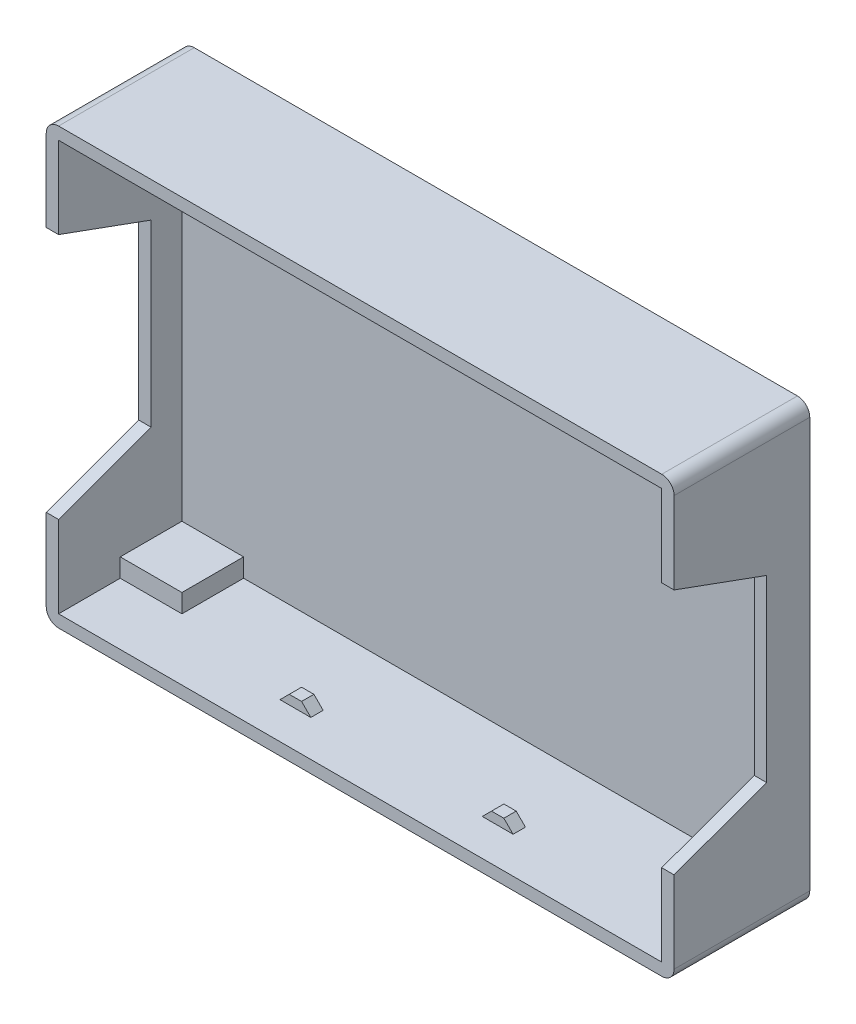
from build123d import *

# Parameters (mm, degrees)
SKETCH1_W                            = 70.5
SKETCH1_H                            = 101.8
SKETCH1_W_2                          = 66.5
SKETCH1_H_2                          = 97.8
BOSS_EXTRUDE1_BOARD_4MM_DEPTH        = 10
SKETCH2_W                            = 101.8
SKETCH2_H                            = 70.5
BOSS_EXTRUDE2_UNDER_10MS_DEPTH       = 10
SKETCH3_W                            = 101.8
SKETCH3_H                            = 70.5
BOSS_EXTRUDE3_BOTTOM_COVER_2MM_DEPTH = 2
SKETCH4_W                            = 5
SKETCH4_H                            = 3.5
BOSS_EXTRUDE4_DEPTH                  = 2
SKETCH5_W                            = 128.386338002
SKETCH5_H                            = 40
CUT_EXTRUDE1_CUT_USB_DEPTH           = 15
CUT_EXTRUDE1_CUT_USB_DRAFT           = -20
FILLET1_R                            = 2
CHAMFER2_START                       = 2.1
CHAMFER2_DEPTH                       = 2
CHAMFER2_2_DEPTH                     = 2


with BuildPart() as part:
    # Sketch1 → Boss-Extrude1-board-4mm (new body)
    with BuildSketch(Plane(origin=(0, 0, 0), x_dir=(0, 1, 0), z_dir=(0, 0, 1))):
        Rectangle(SKETCH1_W, SKETCH1_H)
        Rectangle(SKETCH1_W_2, SKETCH1_H_2, mode=Mode.SUBTRACT)
    extrude(amount=BOSS_EXTRUDE1_BOARD_4MM_DEPTH)

    # Sketch2 → Boss-Extrude2-under-10ms (add)
    with BuildSketch(Plane(origin=(0, 0, 0), x_dir=(1, 0, 0), z_dir=(0, 0, -1))):
        Rectangle(SKETCH2_W, SKETCH2_H)
        Polygon((-48.9, 30.25), (-38.9, 30.25), (-38.9, 33.25), (38.9, 33.25), (38.9, 30.25), (48.9, 30.25), (48.9, -30.25), (38.9, -30.25), (38.9, -33.25), (-38.9, -33.25), (-38.9, -30.25), (-48.9, -30.25), align=None, mode=Mode.SUBTRACT)
    extrude(amount=BOSS_EXTRUDE2_UNDER_10MS_DEPTH)

    # Sketch3 → Boss-Extrude3-bottom-cover-2mm (add)
    with BuildSketch(Plane(origin=(0, 0, -10), x_dir=(1, 0, 0), z_dir=(0, 0, -1))):
        Rectangle(SKETCH3_W, SKETCH3_H)
    extrude(amount=BOSS_EXTRUDE3_BOTTOM_COVER_2MM_DEPTH)

    # Sketch4 → Boss-Extrude4 (add)
    with BuildSketch(Plane.XY.offset(2.1)):
        with Locations((-16.4, 33.5)):
            Rectangle(SKETCH4_W, SKETCH4_H)
        with Locations((-16.4, -33.5)):
            Rectangle(SKETCH4_W, SKETCH4_H)
        with Locations((16.4, -33.5)):
            Rectangle(SKETCH4_W, SKETCH4_H)
        with Locations((16.4, 33.5)):
            Rectangle(SKETCH4_W, SKETCH4_H)
    extrude(amount=BOSS_EXTRUDE4_DEPTH)


with BuildPart() as cut_extrude1_cut_usb_tool:
    # Sketch5 → Cut-Extrude1-cut-usb (with draft: the straight prism first)
    with BuildSketch(Plane.XY.offset(10)):
        Rectangle(SKETCH5_W, SKETCH5_H)
    extrude(amount=-CUT_EXTRUDE1_CUT_USB_DEPTH)
    # Cut-Extrude1-cut-usb: the draft: its side faces are tilted about the plane it starts from
    cut_extrude1_cut_usb_sides = [cut_extrude1_cut_usb_tool.faces().sort_by_distance(p)[0] for p in [
        (0, -20, 2.5),
        (64.193169001, 0, 2.5),
        (0, 20, 2.5),
        (-64.193169001, 0, 2.5),
    ]]
    draft(cut_extrude1_cut_usb_sides, Plane.XY.offset(10), CUT_EXTRUDE1_CUT_USB_DRAFT)


with BuildPart() as part_1:
    add(part.part)

    # Cut-Extrude1-cut-usb: cut by cut_extrude1_cut_usb_tool
    add(cut_extrude1_cut_usb_tool.part, mode=Mode.SUBTRACT)

    # Fillet1
    fillet1_edges = [part_1.edges().sort_by_distance(p)[0] for p in [
        (50.9, -35.25, -1),
        (-50.9, -35.25, -1),
        (-50.9, 35.25, -1),
        (50.9, 35.25, -1),
    ]]
    fillet(fillet1_edges, radius=FILLET1_R)

    # Chamfer2: read off the stored shape, not the designer's step
    # Chamfer2 outline → Chamfer2 (cut)
    with BuildSketch(Plane.XY.offset(CHAMFER2_START)):
        Polygon((-18.9, -31.75), (-18.9, -33.25), (-17.4, -31.75), align=None)
        Polygon((-13.9, -31.75), (-15.4, -31.75), (-13.9, -33.25), align=None)
        Polygon((13.9, -31.75), (13.9, -33.25), (15.4, -31.75), align=None)
        Polygon((18.9, -31.75), (17.4, -31.75), (18.9, -33.25), align=None)
    extrude(amount=CHAMFER2_DEPTH, mode=Mode.SUBTRACT)

    # Chamfer2 2 outline → Chamfer2 2 (add)
    with BuildSketch(Plane.XY.offset(CHAMFER2_START)):
        Polygon((-18.9, 31.75), (-18.9, 33.25), (-20.4, 33.25), align=None)
        Polygon((-13.9, 31.75), (-12.4, 33.25), (-13.9, 33.25), align=None)
        Polygon((20.4, 33.25), (18.9, 33.25), (18.9, 31.75), align=None)
        Polygon((12.4, 33.25), (13.9, 31.75), (13.9, 33.25), align=None)
    extrude(amount=CHAMFER2_2_DEPTH)


solid = part_1.part
